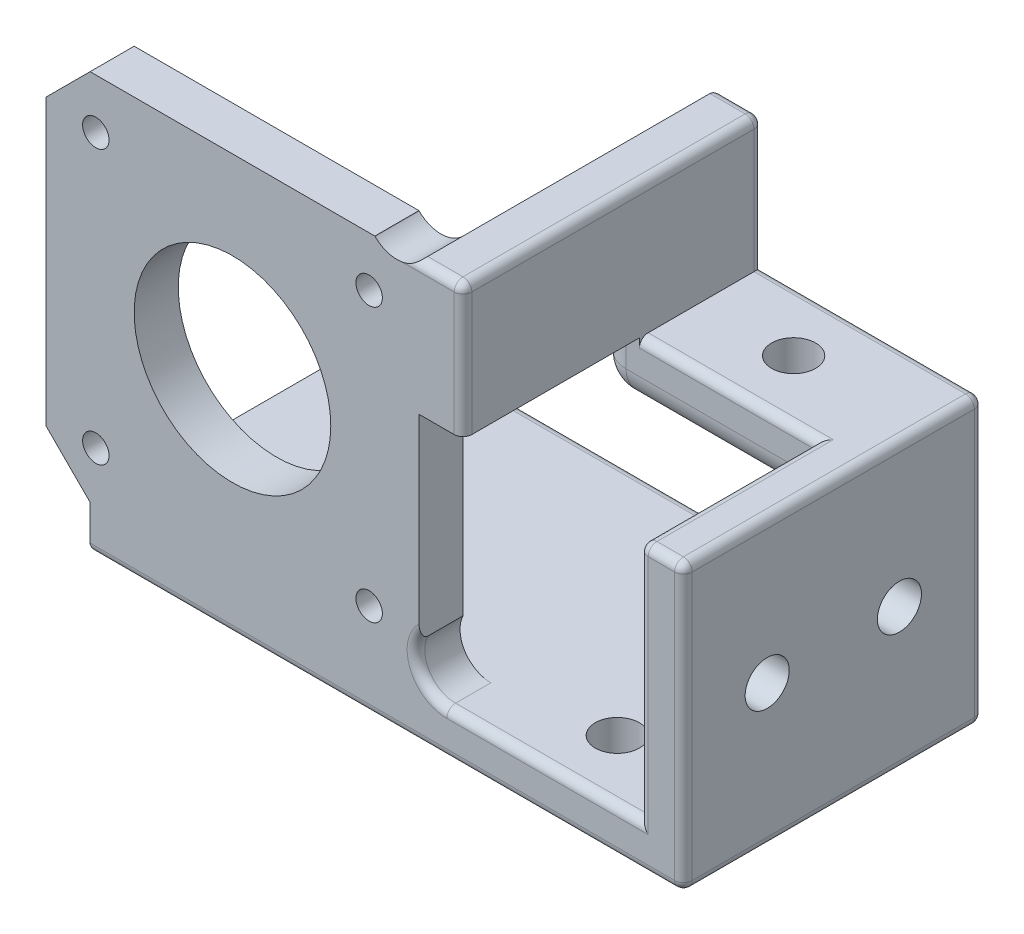
from build123d import *
from OCP.BRepAlgoAPI import BRepAlgoAPI_Cut
from OCP.TopTools import TopTools_ListOfShape

# Parameters (mm, degrees)
SKETCH_1_R          = 11.15
SKETCH_1_R_2        = 1.5
EXTRUDE_1_DEPTH     = 5
SKETCH_2_W          = 14
SKETCH_2_H          = 10
SKETCH_2_W_2        = 15
SKETCH_2_W_3        = 5
SKETCH_2_H_2        = 5
EXTRUDE_2_DEPTH     = 5
SKETCH_2_3_W        = 14
SKETCH_2_3_H        = 7.3
EXTRUDE_6_DEPTH     = 25
SKETCH_6_W          = 14
SKETCH_6_H          = 7.3
EXTRUDE_7_DEPTH     = 5
SKETCH_7_W          = 67.3
SKETCH_7_H          = 34
EXTRUDE_8_DEPTH     = 5
FILLET_9_R          = 3.5
FILLET_8_R          = 1
FILLET_10_DEPTH     = 4.450151431
FILLET_START        = 4.450151431
FILLET_10_2_DEPTH   = 0.549848569
FILLET_START_2      = 19.24183889
FILLET_10_3_DEPTH   = 1.90816111
FILLET_11_R         = 3.5
SKETCH_8_R          = 2.5
CUT_EXTRUDE_1_DEPTH = 5
SKETCH_9_R          = 2.5
CUT_EXTRUDE_2_DEPTH = 5
SKETCH_10_R         = 2.5
CUT_EXTRUDE_3_DEPTH = 5


with BuildPart() as part:
    # 스케치1 → 보스-돌출1 (new body)
    with BuildSketch(Plane.XY):
        Polygon((-21.15, -16.15), (-21.15, 16.15), (-16.15, 21.15), (16.15, 21.15), (21.15, 16.15), (21.15, -16.15), (16.15, -21.15), (-16.15, -21.15), align=None)
        Circle(SKETCH_1_R, mode=Mode.SUBTRACT)
        with Locations((15.5, 15.5)):
            Circle(SKETCH_1_R_2, mode=Mode.SUBTRACT)
        with Locations((-15.5, 15.5)):
            Circle(SKETCH_1_R_2, mode=Mode.SUBTRACT)
        with Locations((15.5, -15.5)):
            Circle(SKETCH_1_R_2, mode=Mode.SUBTRACT)
        with Locations((-15.5, -15.5)):
            Circle(SKETCH_1_R_2, mode=Mode.SUBTRACT)
    extrude(amount=EXTRUDE_1_DEPTH)

    # 스케치2 → 보스-돌출2 (add)
    with BuildSketch(Plane(origin=(21.15, 0, 0), x_dir=(0, 0, -1), z_dir=(1, 0, 0))):
        with Locations((22, 11.15)):
            Rectangle(SKETCH_2_W, SKETCH_2_H)
        with Locations((7.5, 11.15)):
            Rectangle(SKETCH_2_W_2, SKETCH_2_H)
        with Locations((-2.5, 11.15)):
            Rectangle(SKETCH_2_W_3, SKETCH_2_H)
        with Locations((-2.5, 18.65)):
            Rectangle(SKETCH_2_W_3, SKETCH_2_H_2)
        with Locations((7.5, 18.65)):
            Rectangle(SKETCH_2_W_2, SKETCH_2_H_2)
        with Locations((22, 18.65)):
            Rectangle(SKETCH_2_W, SKETCH_2_H_2)
    extrude(amount=EXTRUDE_2_DEPTH)

    # 스케치2<3> → 보스-돌출6 (add)
    with BuildSketch(Plane(origin=(21.15, 0, 0), x_dir=(0, 0, -1), z_dir=(1, 0, 0))):
        with Locations((22, 2.5)):
            Rectangle(SKETCH_2_3_W, SKETCH_2_3_H)
    extrude(amount=EXTRUDE_6_DEPTH)

    # 스케치6 → 보스-돌출7 (add)
    with BuildSketch(Plane(origin=(46.15, 0, 0), x_dir=(0, 0, -1), z_dir=(1, 0, 0))):
        with Locations((22, 2.5)):
            Rectangle(SKETCH_6_W, SKETCH_6_H)
        Polygon((15, -1.15), (15, 6.15), (-5, 6.15), (-5, -21.15), (29, -21.15), (29, -1.15), align=None)
    extrude(amount=EXTRUDE_7_DEPTH)

    # 스케치7 → 보스-돌출8 (add)
    with BuildSketch(Plane.XZ.offset(21.15)):
        with Locations((17.5, -12)):
            Rectangle(SKETCH_7_W, SKETCH_7_H)
    extrude(amount=EXTRUDE_8_DEPTH)

    # 필렛9
    # the kernel refuses this fillet: 3.5 mm, written as the material it adds along each edge
    with BuildSketch(Plane(origin=(16.15, -21.15, 0), x_dir=(1, 0, 0), z_dir=(0, 0, 1))) as fillet_9_piece_1:
        with BuildLine():
            CenterArc((8.16227766, 3.5), FILLET_9_R, 154.623066475, 115.376933525)
            Line((5, 5), (0, 0))
            Line((0, 0), (8.16227766, 0))
        make_face()
    extrude(amount=5)

    # 필렛8
    fillet_8_edges = [part.edges().sort_by_distance(p)[0] for p in [
        (17.5, -26.15, -29),
        (21.354237769, -19.520828693, 5),
        (21.15, 10, -29),
        (26.15, 21.15, -12),
        (23.65, 21.15, -29),
        (23.65, 21.15, 5),
        (26.15, 13.65, -29),
        (26.15, 13.65, 5),
        (36.15, 6.15, -15),
        (33.65, -1.15, -29),
        (38.65, 6.15, -29),
        (46.15, 6.15, -5),
        (46.15, -7.5, 5),
        (48.65, 6.15, 5),
        (46.15, -11.15, -29),
        (51.15, 6.15, -12),
        (51.15, -10, 5),
        (51.15, -10, -29),
        (35.23113883, -21.15, 5),
        (15, -21.15, -29),
        (-16.15, -23.65, -29),
        (51.15, -26.15, -12),
        (17.5, -26.15, 5),
        (-16.15, -26.15, -12),
    ]]
    fillet(fillet_8_edges, radius=FILLET_8_R)


with BuildPart() as fillet_10_tool:
    # 필렛10: read off the stored shape, not the designer's step
    # 필렛10 outline → 필렛10 (new body)
    with BuildSketch(Plane.XY):
        with BuildLine():
            ThreePointArc((21.150000872, 21.15000089), (18.667895356, 20.099665017), (16.175253817, 21.124746183))
            Line((16.175253817, 21.124746183), (21.15, 16.15))
            Line((21.15, 16.15), (21.150000872, 21.15000089))
        make_face()
    extrude(amount=FILLET_10_DEPTH)


with BuildPart() as part_1:
    add(part.part)


with BuildPart() as part_2:
    # 필렛10: joined with fillet_10_tool
    add(part_1.part.fuse(fillet_10_tool.part, tol=0.00001))


with BuildPart() as fillet_10_2_tool:
    # Fillet 10 2 outline → Fillet 10 2 (new body)
    with BuildSketch(Plane.XY.offset(FILLET_START)):
        with BuildLine():
            ThreePointArc((21.150000872, 21.15000089), (18.667895356, 20.099665017), (16.175253817, 21.124746183))
            Line((16.175253817, 21.124746183), (21.15, 16.15))
            Line((21.15, 16.15), (21.15, 21.042952232))
            Line((21.15, 21.042952232), (21.150000872, 21.15000089))
        make_face()
    extrude(amount=FILLET_10_2_DEPTH)


with BuildPart() as part_3:
    add(part_2.part)


with BuildPart() as part_4:
    # Fillet 10 2: joined with fillet_10_2_tool
    add(part_3.part.fuse(fillet_10_2_tool.part, tol=0.00001))


with BuildPart() as fillet_10_3_tool:
    # Fillet 10 3 outline → Fillet 10 3 (new body)
    with BuildSketch(Plane.YZ.offset(FILLET_START_2)):
        with BuildLine():
            Line((19, 5.000000001), (20.15, 5))
            ThreePointArc((20.15, 5), (20.857106781, 4.707106781), (21.15, 4))
            Line((21.15, 4), (21.150000003, -1))
            Line((21.150000003, -1), (23, -1))
            Line((23, -1), (23, 6))
            Line((23, 6), (19, 6))
            Line((19, 6), (19, 5.000000001))
        make_face()
    extrude(amount=FILLET_10_3_DEPTH)


with BuildPart() as part_5:
    add(part_4.part)

    # Fillet 10 3: cut by fillet_10_3_tool, with a tolerance
    fillet_10_3_stock = TopTools_ListOfShape()
    fillet_10_3_stock.Append(part_5.part.wrapped)
    fillet_10_3_tools = TopTools_ListOfShape()
    fillet_10_3_tools.Append(fillet_10_3_tool.part.wrapped)
    fillet_10_3_cut = BRepAlgoAPI_Cut()
    fillet_10_3_cut.SetArguments(fillet_10_3_stock)
    fillet_10_3_cut.SetTools(fillet_10_3_tools)
    fillet_10_3_cut.SetFuzzyValue(0.00001)
    fillet_10_3_cut.Build()
    add(Compound.cast(fillet_10_3_cut.Shape()).solids(), mode=Mode.REPLACE)

    # 필렛11
    # the kernel refuses this fillet: 3.5 mm, written as the material it takes off along each edge
    with BuildSketch(Plane(origin=(24.65, 2.35, -29), x_dir=(0, -1, 0), z_dir=(1, 0, 0))) as fillet_11_piece_1:
        with BuildLine():
            CenterArc((2.5, -1), 1, 0, 90)
            Line((3.5, -1), (3.5, 0))
            Line((3.5, 0), (2.5, 0))
        make_face()
    revolve(axis=Axis((24.65, 2.35, -29), (0, 0, -1)), revolution_arc=90, mode=Mode.SUBTRACT)
    with BuildSketch(Plane(origin=(24.65, 2.35, -18.5), x_dir=(-1, 0, 0), z_dir=(0, 0, 1))) as fillet_11_piece_2_section:
        Polygon((0, 0), (FILLET_11_R, 0), (FILLET_11_R, FILLET_11_R), (0, FILLET_11_R), align=None)
    fillet_11_piece_2 = extrude(amount=FILLET_11_R, mode=Mode.PRIVATE)
    fillet_11_piece_2 = fillet_11_piece_2 - Plane(origin=(24.65, 2.35, -18.5), x_dir=(0.7071067811865475, 0.7071067811865475, 0), z_dir=(0, 0, 1)) * Sphere(FILLET_11_R, mode=Mode.PRIVATE)
    add(fillet_11_piece_2, mode=Mode.SUBTRACT)
    with BuildSketch(Plane(origin=(21.15, 6.15, -15), x_dir=(1, 0, 0), z_dir=(0, -1, 0))) as fillet_11_piece_3:
        with BuildLine():
            CenterArc((FILLET_11_R, -FILLET_11_R), FILLET_11_R, 90, 90)
            Line((0, -FILLET_11_R), (0, 0))
            Line((0, 0), (FILLET_11_R, 0))
        make_face()
    extrude(amount=3.8, mode=Mode.SUBTRACT)
    with BuildSketch(Plane(origin=(21.15, -1.15, -18.5), x_dir=(0, 1, 0), z_dir=(0, 0, -1))) as fillet_11_piece_4:
        with BuildLine():
            CenterArc((FILLET_11_R, FILLET_11_R), FILLET_11_R, 180, 90)
            Line((0, FILLET_11_R), (0, 0))
            Line((0, 0), (FILLET_11_R, 0))
        make_face()
    extrude(amount=10.5, mode=Mode.SUBTRACT)
    with BuildSketch(Plane(origin=(24.65, -1.15, -15), x_dir=(0, 1, 0), z_dir=(1, 0, 0))) as fillet_11_piece_5:
        with BuildLine():
            CenterArc((FILLET_11_R, -FILLET_11_R), FILLET_11_R, 90, 90)
            Line((0, -FILLET_11_R), (0, 0))
            Line((0, 0), (FILLET_11_R, 0))
        make_face()
    extrude(amount=21.5, mode=Mode.SUBTRACT)

    # 스케치8 → 컷-돌출1 (cut)
    with BuildSketch(Plane(origin=(0, 6.15, 0), x_dir=(1, 0, 0), z_dir=(0, 1, 0))):
        with Locations(Location((36.65, 22, 0), (0, 0, 270))):
            Circle(SKETCH_8_R)
    extrude(amount=-CUT_EXTRUDE_1_DEPTH, mode=Mode.SUBTRACT)

    # 스케치9 → 컷-돌출2 (cut)
    with BuildSketch(Plane(origin=(51.15, 0, 0), x_dir=(0, 0, -1), z_dir=(1, 0, 0))):
        with Locations((4.5, -10)):
            Circle(SKETCH_9_R)
        with Locations((19.5, -10)):
            Circle(SKETCH_9_R)
    extrude(amount=-CUT_EXTRUDE_2_DEPTH, mode=Mode.SUBTRACT)

    # 스케치10 → 컷-돌출3 (cut)
    with BuildSketch(Plane(origin=(0, -21.15, 0), x_dir=(1, 0, 0), z_dir=(0, 1, 0))):
        with Locations(Location((36.65, 22, 0), (0, 0, 270))):
            Circle(SKETCH_10_R)
        with Locations(Location((36.65, 12, 0), (0, 0, 270))):
            Circle(SKETCH_10_R)
        with Locations(Location((36.65, 2, 0), (0, 0, 270))):
            Circle(SKETCH_10_R)
    extrude(amount=-CUT_EXTRUDE_3_DEPTH, mode=Mode.SUBTRACT)


solid = part_5.part
